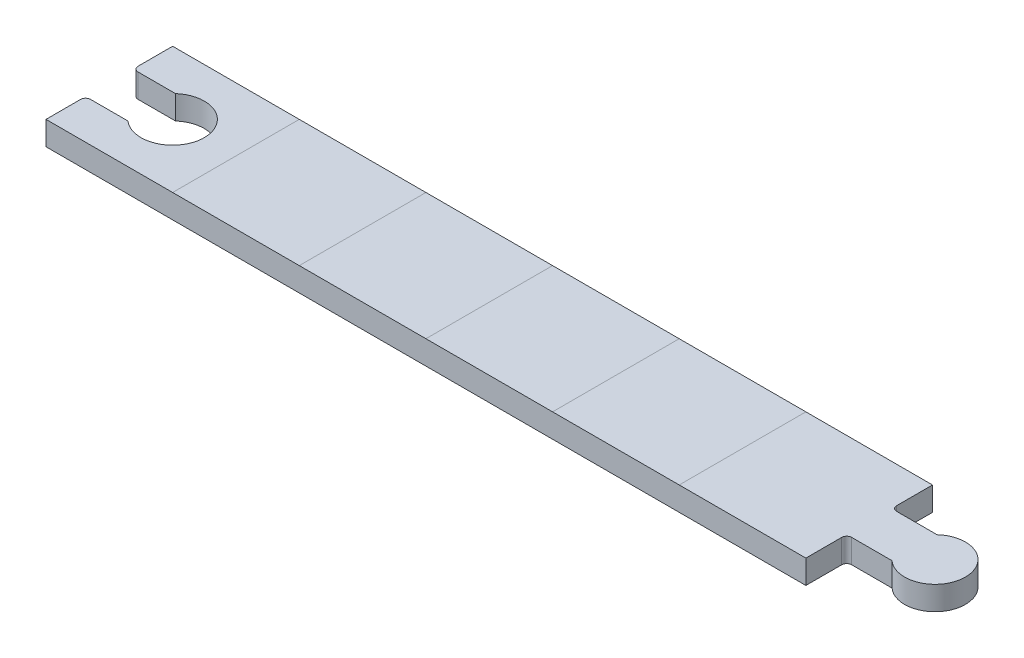
from build123d import *

# Parameters (mm, degrees)
BOSS_EXTRUDE1_DEPTH = 4.7625
FILLET1_R           = 1


with BuildPart() as part:
    # Sketch1 → Boss-Extrude1 (new body)
    with BuildSketch(Plane(origin=(0, 0, 0), x_dir=(1, 0, 0), z_dir=(0, 1, 0))):
        with BuildLine():
            Line((-76.2, -12.7), (76.2, -12.7))
            Line((76.2, -12.7), (76.2, -4.5125))
            Line((76.2, -4.5125), (85.295448411, -4.5125))
            ThreePointArc((85.295448411, -4.5125), (95.5, 0), (85.295448411, 4.5125))
            Line((85.295448411, 4.5125), (76.2, 4.5125))
            Line((76.2, 4.5125), (76.2, 12.7))
            Line((76.2, 12.7), (-76.2, 12.7))
            Line((-76.2, 12.7), (-76.2, 4.7625))
            Line((-76.2, 4.7625), (-67.700130206, 4.7625))
            ThreePointArc((-67.700130206, 4.7625), (-57.15, 0), (-67.700130206, -4.7625))
            Line((-67.700130206, -4.7625), (-76.2, -4.7625))
            Line((-76.2, -4.7625), (-76.2, -12.7))
        make_face()
    extrude(amount=BOSS_EXTRUDE1_DEPTH)

    # Fillet1
    fillet1_edges = [part.edges().sort_by_distance(p)[0] for p in [
        (-76.2, 2.38125, 4.7625),
        (-76.2, 2.38125, -4.7625),
        (76.2, 2.38125, -4.5125),
        (76.2, 2.38125, 4.5125),
    ]]
    fillet(fillet1_edges, radius=FILLET1_R)


solid = part.part
